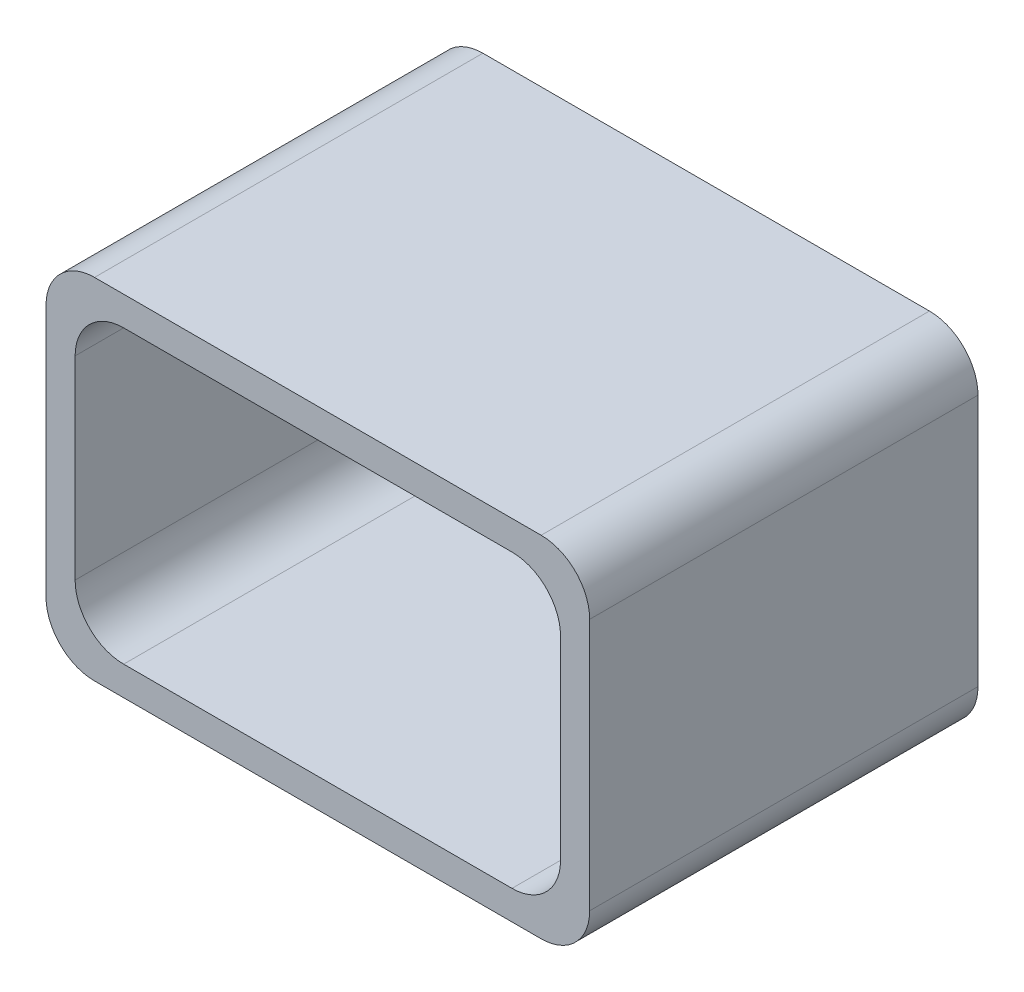
from build123d import *

# Parameters (mm, degrees)
SKETCH1_W           = 0.56
SKETCH1_H           = 0.36
SKETCH1_W_2         = 0.5
SKETCH1_H_2         = 0.3
BOSS_EXTRUDE1_DEPTH = 0.4
FILLET1_R           = 0.05


with BuildPart() as part:
    # Sketch1 → Boss-Extrude1 (new body)
    with BuildSketch(Plane.XY):
        with Locations((0.28, 0.18)):
            Rectangle(SKETCH1_W, SKETCH1_H)
        with Locations((0.28, 0.18)):
            Rectangle(SKETCH1_W_2, SKETCH1_H_2, mode=Mode.SUBTRACT)
    extrude(amount=BOSS_EXTRUDE1_DEPTH)

    # Fillet1
    fillet1_edges = [part.edges().sort_by_distance(p)[0] for p in [
        (0.56, 0, 0.2),
        (0, 0, 0.2),
        (0.56, 0.36, 0.2),
        (0, 0.36, 0.2),
        (0.53, 0.03, 0.2),
        (0.53, 0.33, 0.2),
        (0.03, 0.03, 0.2),
        (0.03, 0.33, 0.2),
    ]]
    fillet(fillet1_edges, radius=FILLET1_R)


solid = part.part
